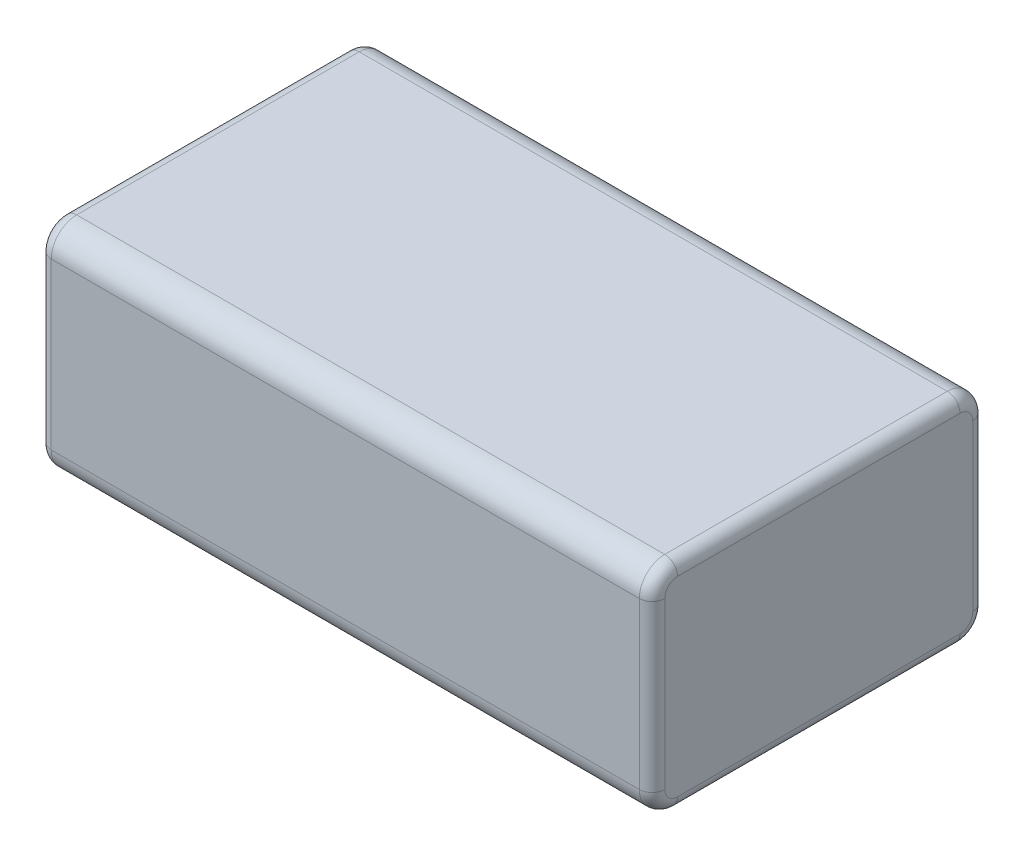
from build123d import *

# Parameters (mm, degrees)
SKETCH1_W           = 48.15
SKETCH1_H           = 26.17
BOSS_EXTRUDE1_DEPTH = 16.98
FILLET1_R           = 2
FILLET2_R           = 1
SKETCH2_R           = 3.665
SKETCH2_R_2         = 3.4
BOSS_EXTRUDE2_DEPTH = 3
FILLET6_R           = 0.3
FILLET10_R          = 0.1


with BuildPart() as part:
    # Sketch1 → Boss-Extrude1 (new body)
    with BuildSketch(Plane(origin=(0, 0, 0), x_dir=(1, 0, 0), z_dir=(0, 1, 0))):
        Rectangle(SKETCH1_W, SKETCH1_H)
    extrude(amount=BOSS_EXTRUDE1_DEPTH)

    # Fillet1
    fillet1_edges = [part.edges().sort_by_distance(p)[0] for p in [
        (0, 16.98, -13.085),
        (0, 0, -13.085),
        (0, 0, 13.085),
        (0, 16.98, 13.085),
    ]]
    fillet(fillet1_edges, radius=FILLET1_R)

    # Fillet2
    fillet2_edges = [part.edges().sort_by_distance(p)[0] for p in [
        (-24.075, 8.49, -13.085),
        (24.075, 8.49, -13.085),
        (-24.075, 0, 0),
        (-24.075, 8.49, 13.085),
        (-24.075, 16.98, 0),
        (-24.075, 16.394213562, 12.499213562),
        (-24.075, 16.394213562, -12.499213562),
        (-24.075, 0.585786438, 12.499213562),
        (-24.075, 0.585786438, -12.499213562),
        (24.075, 0, 0),
        (24.075, 16.98, 0),
        (24.075, 8.49, 13.085),
        (24.075, 16.394213562, 12.499213562),
        (24.075, 16.394213562, -12.499213562),
        (24.075, 0.585786438, 12.499213562),
        (24.075, 0.585786438, -12.499213562),
    ]]
    fillet(fillet2_edges, radius=FILLET2_R)

    # Sketch2 → Boss-Extrude2 (add)
    # profile 1 of 2: a face of its own
    with BuildSketch(Plane.ZY.offset(24.075)):
        with Locations(Location((-5.451156858, 8.49, 0), (0, 0, 180))):
            Circle(SKETCH2_R)
        with Locations((-5.451156858, 8.49)):
            Circle(SKETCH2_R_2, mode=Mode.SUBTRACT)
    # profile 2 of 2: a face of its own
    with BuildSketch(Plane.ZY.offset(24.075)):
        Polygon((4.510660825, 13.124360065), (0.610660825, 10.872694015), (0.610660825, 6.369361915), (4.510660825, 4.117695866), (8.410660825, 6.369361915), (8.410660825, 10.872694015), align=None)
        with Locations((4.510660825, 8.621027965)):
            Circle(SKETCH2_R, mode=Mode.SUBTRACT)
    extrude(amount=BOSS_EXTRUDE2_DEPTH)

    # Fillet6
    # the kernel refuses this fillet: 0.3 mm, written as the material it takes off along each edge
    with BuildSketch(Plane(origin=(-27.075, 8.621027965, 4.510660825), x_dir=(0, 0, 1), z_dir=(0, -1, 0))) as fillet6_piece_1:
        with BuildLine():
            CenterArc((3.665 + FILLET6_R, -FILLET6_R), FILLET6_R, 90, 90)
            Line((3.665, -FILLET6_R), (3.665, 0))
            Line((3.665, 0), (3.665 + FILLET6_R, 0))
        make_face()
    revolve(axis=Axis((-27.075, 8.621027965, 4.510660825), (-1, 0, 0)), mode=Mode.SUBTRACT)
    with BuildSketch(Plane(origin=(-27.075, 10.497694015, 9.060179878), x_dir=(1, 0, 0), z_dir=(0, 0.5000000000000002, -0.8660254037844386)), Plane(origin=(-27.075, 13.499360065, 5.160179878), x_dir=(1, 0, 0), z_dir=(0, -0.5000000000000002, -0.8660254037844386)), Plane(origin=(-27.075, 11.622694015, 0.610660825), x_dir=(1, 0, 0), z_dir=(0, -1, 0)), Plane(origin=(-27.075, 6.744361915, -0.038858228), x_dir=(1, 0, 0), z_dir=(0, -0.5000000000000002, 0.8660254037844386)), Plane(origin=(-27.075, 3.742695866, 3.861141772), x_dir=(1, 0, 0), z_dir=(0, 0.49999999999999983, 0.8660254037844388)), Plane(origin=(-27.075, 5.619361915, 8.410660825), x_dir=(1, 0, 0), z_dir=(0, 1, 0))) as fillet6_piece_2:
        with BuildLine():
            CenterArc((FILLET6_R, FILLET6_R), FILLET6_R, 180, 90)
            Line((0, FILLET6_R), (0, 0))
            Line((0, 0), (FILLET6_R, 0))
        make_face()
    extrude(amount=6.0033321, mode=Mode.SUBTRACT)

    # Fillet10
    fillet10_edges = [part.edges().sort_by_distance(p)[0] for p in [
        (-27.075, 8.49, -1.786156858),
        (-27.075, 8.49, -8.851156858),
    ]]
    fillet(fillet10_edges, radius=FILLET10_R)


solid = part.part
